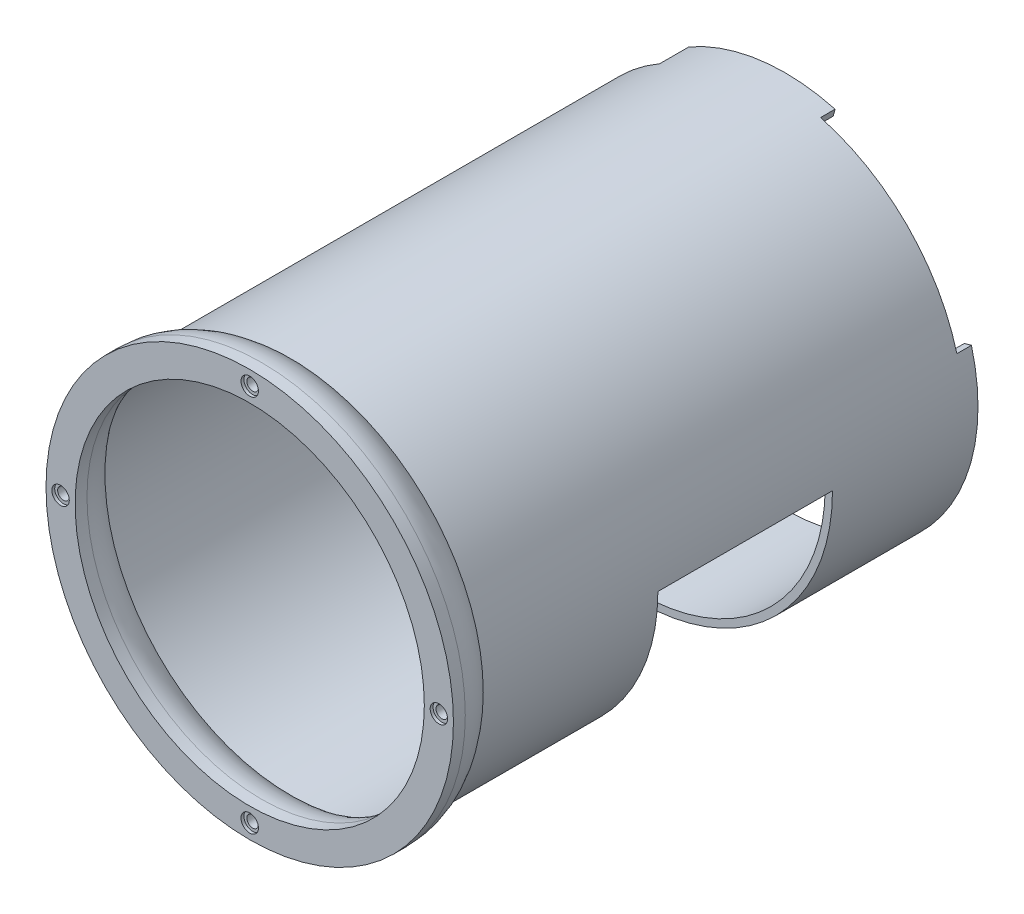
from build123d import *

# Parameters (mm, degrees)
SKIZZE1_R                       = 70
SKIZZE1_R_2                     = 60
AUFSATZ_LINEAR_AUSTRAGEN1_DEPTH = 14
AUFSATZ_LINEAR_START            = -14
SKIZZE10_R                      = 66.25
SKIZZE10_R_2                    = 63.75
AUFSATZ_LINEAR_AUSTRAGEN2_DEPTH = 170
SCHNITT_LINEAR_START            = -74
SCHNITT_LINEAR_AUSTRAGEN1_DEPTH = 60
SCHNITT_LINEAR_START_2          = -174
SCHNITT_LINEAR_AUSTRAGEN3_DEPTH = 10
SCHNITT_LINEAR_START_3          = -179
SCHNITT_LINEAR_AUSTRAGEN4_DEPTH = 5
SKIZZE3_R                       = 2
SCHNITT_LINEAR_AUSTRAGEN5_DEPTH = 7
SKIZZE9_R                       = 3
SCHNITT_LINEAR_AUSTRAGEN6_DEPTH = 1
VERRUNDUNG4_R                   = 15
VERRUNDUNG5_R                   = 15


with BuildPart() as part:
    # Skizze1 → Aufsatz-Linear austragen1 (new body)
    with BuildSketch(Plane(origin=(0, 0, 0), x_dir=(0, 1, 0), z_dir=(0, 0, 1))):
        with Locations(Location((0, 0, 0), (0, 0, 270))):
            Circle(SKIZZE1_R)
        with Locations(Location((0, 0, 0), (0, 0, 270))):
            Circle(SKIZZE1_R_2, mode=Mode.SUBTRACT)
    extrude(amount=-AUFSATZ_LINEAR_AUSTRAGEN1_DEPTH)

    # Skizze10 → Aufsatz-Linear austragen2 (add)
    with BuildSketch(Plane.XY.offset(AUFSATZ_LINEAR_START)):
        Circle(SKIZZE10_R)
        Circle(SKIZZE10_R_2, mode=Mode.SUBTRACT)
    extrude(amount=-AUFSATZ_LINEAR_AUSTRAGEN2_DEPTH)

    # Skizze4 → Schnitt-Linear austragen1 (cut)
    with BuildSketch(Plane(origin=(0, 0, 0), x_dir=(0, 1, 0), z_dir=(0, 0, 1)).offset(SCHNITT_LINEAR_START)):
        with BuildLine():
            Line((-70, 0), (-60, 0))
            ThreePointArc((-60, 0), (-42.426406871, -42.426406871), (0, -60))
            Line((0, -60), (0, -70))
            ThreePointArc((0, -70), (-49.497474683, -49.497474683), (-70, 0))
        make_face()
    extrude(amount=-SCHNITT_LINEAR_AUSTRAGEN1_DEPTH, mode=Mode.SUBTRACT)

    # Skizze5 → Schnitt-Linear austragen3 (cut)
    with BuildSketch(Plane(origin=(0, 0, 0), x_dir=(0, 1, 0), z_dir=(0, 0, 1)).offset(SCHNITT_LINEAR_START_2)):
        with BuildLine():
            Line((30, 51.961524227), (35, 60.621778265))
            ThreePointArc((35, 60.621778265), (49.497474683, 49.497474683), (60.621778265, 35))
            Line((60.621778265, 35), (51.961524227, 30))
            ThreePointArc((51.961524227, 30), (42.426406871, 42.426406871), (30, 51.961524227))
        make_face()
    extrude(amount=-SCHNITT_LINEAR_AUSTRAGEN3_DEPTH, mode=Mode.SUBTRACT)

    # Skizze6 → Schnitt-Linear austragen4 (cut)
    with BuildSketch(Plane(origin=(0, 0, 0), x_dir=(0, 1, 0), z_dir=(0, 0, 1)).offset(SCHNITT_LINEAR_START_3)):
        with BuildLine():
            Line((57.955549577, -15.529142706), (67.61480784, -18.117333157))
            ThreePointArc((67.61480784, -18.117333157), (49.497474683, -49.497474683), (18.117333157, -67.61480784))
            Line((18.117333157, -67.61480784), (15.529142706, -57.955549577))
            ThreePointArc((15.529142706, -57.955549577), (42.426406871, -42.426406871), (57.955549577, -15.529142706))
        make_face()
    extrude(amount=-SCHNITT_LINEAR_AUSTRAGEN4_DEPTH, mode=Mode.SUBTRACT)

    # Skizze3 → Schnitt-Linear austragen5 (cut)
    with BuildSketch(Plane(origin=(0, 0, 0), x_dir=(0, 1, 0), z_dir=(0, 0, 1))):
        with Locations(Location((-65, 0, 0), (0, 0, 270))):
            Circle(SKIZZE3_R)
        with Locations(Location((0, 65, 0), (0, 0, 270))):
            Circle(SKIZZE3_R)
        with Locations(Location((65, 0, 0), (0, 0, 270))):
            Circle(SKIZZE3_R)
        with Locations(Location((0, -65, 0), (0, 0, 270))):
            Circle(SKIZZE3_R)
    extrude(amount=-SCHNITT_LINEAR_AUSTRAGEN5_DEPTH, mode=Mode.SUBTRACT)

    # Skizze9 → Schnitt-Linear austragen6 (cut)
    with BuildSketch(Plane(origin=(0, 0, 0), x_dir=(0, 1, 0), z_dir=(0, 0, 1))):
        with Locations(Location((0, 65, 0), (0, 0, 270))):
            Circle(SKIZZE9_R)
        with Locations(Location((65, 0, 0), (0, 0, 270))):
            Circle(SKIZZE9_R)
        with Locations(Location((0, -65, 0), (0, 0, 270))):
            Circle(SKIZZE9_R)
        with Locations(Location((-65, 0, 0), (0, 0, 270))):
            Circle(SKIZZE9_R)
    extrude(amount=-SCHNITT_LINEAR_AUSTRAGEN6_DEPTH, mode=Mode.SUBTRACT)

    # Verrundung4
    # the kernel refuses this fillet: 15 mm, written as the material it takes off along each edge
    with BuildSketch(Plane(origin=(0, 0, -14), x_dir=(1, 0, 0), z_dir=(0, -1, 0))) as verrundung4_piece_1:
        with BuildLine():
            CenterArc((75, 9.921567416), VERRUNDUNG4_R, 180, 41.409622109)
            Line((63.75, 0), (60, 0))
            Line((60, 0), (60, 9.921567416))
        make_face()
    revolve(axis=Axis((0, 0, -14), (0, 0, 1)), mode=Mode.SUBTRACT)

    # Verrundung5
    # the kernel refuses this fillet: 15 mm, written as the material it takes off along each edge
    with BuildSketch(Plane(origin=(0, 0, -14), x_dir=(1, 0, 0), z_dir=(0, -1, 0))) as verrundung5_piece_1:
        with BuildLine():
            CenterArc((55, 9.921567416), VERRUNDUNG5_R, 318.590377891, 41.409622109)
            Line((66.25, 0), (70, 0))
            Line((70, 0), (70, 9.921567416))
        make_face()
    revolve(axis=Axis((0, 0, -14), (0, 0, 1)), mode=Mode.SUBTRACT)


solid = part.part
